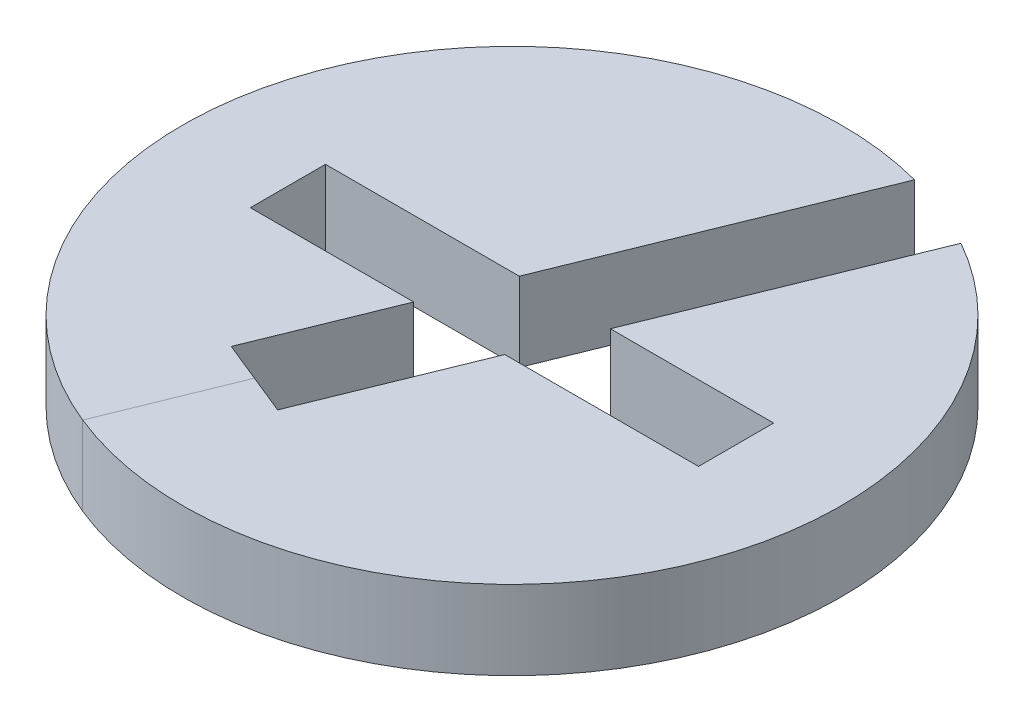
from build123d import *

# Parameters (mm, degrees)
BOSS_EXTRUDE1_DEPTH      = 1.5
BOSS_EXTRUDE1_DEPTH_BACK = 1.5
SKETCH1_R                = 12.5
SKETCH2_W                = 17
SKETCH2_H                = 2.85
CUT_EXTRUDE1_DEPTH       = 18.930421077
CUT_EXTRUDE2_DEPTH       = 18.741194999
CUT_EXTRUDE2_DEPTH_BACK  = 18.741194999


with BuildPart() as part:
    # Sketch1 → Boss-Extrude1 (new, two sides: drawn at the far end of the back side and taken through both)
    with BuildSketch(Plane(origin=(0, 0, 0), x_dir=(1, 0, 0), z_dir=(0, 1, 0)).offset(-BOSS_EXTRUDE1_DEPTH_BACK)):
        Circle(SKETCH1_R)
    extrude(amount=BOSS_EXTRUDE1_DEPTH + BOSS_EXTRUDE1_DEPTH_BACK)

    # Sketch2 → Cut-Extrude1 (cut, through all)
    with BuildSketch(Plane.XZ.offset(1.5)):
        Rectangle(SKETCH2_W, SKETCH2_H)
    extrude(amount=-CUT_EXTRUDE1_DEPTH, mode=Mode.SUBTRACT)

    # Sketch3 → Cut-Extrude2 (cut, two sides: drawn at the far end of the back side and taken through both)
    with BuildSketch(Plane.XZ.offset(-CUT_EXTRUDE2_DEPTH_BACK)):
        Polygon((3.22035748, -12.183566707), (-4.304127783, 6.347005911), (-1.339236164, 7.550923553), (6.185249099, -10.979649065), align=None)
    extrude(amount=CUT_EXTRUDE2_DEPTH + CUT_EXTRUDE2_DEPTH_BACK, mode=Mode.SUBTRACT)


with BuildPart() as body_2:
    # Split2: the piece on the far side of the plane
    add(part.part)
    split(bisect_by=Plane(origin=(0, 0, 0), x_dir=(0.3762242631393602, 0, -0.9265286308718395), z_dir=(-0.9265286308718397, 0, -0.37622426313936025)), keep=Keep.BOTTOM)


with BuildPart() as part_1:
    add(part.part)

    # Split2
    split(bisect_by=Plane(origin=(0, 0, 0), x_dir=(0.3762242631393602, 0, -0.9265286308718395), z_dir=(-0.9265286308718397, 0, -0.37622426313936025)), keep=Keep.TOP)


solid = Compound([body_2.part, part_1.part])
